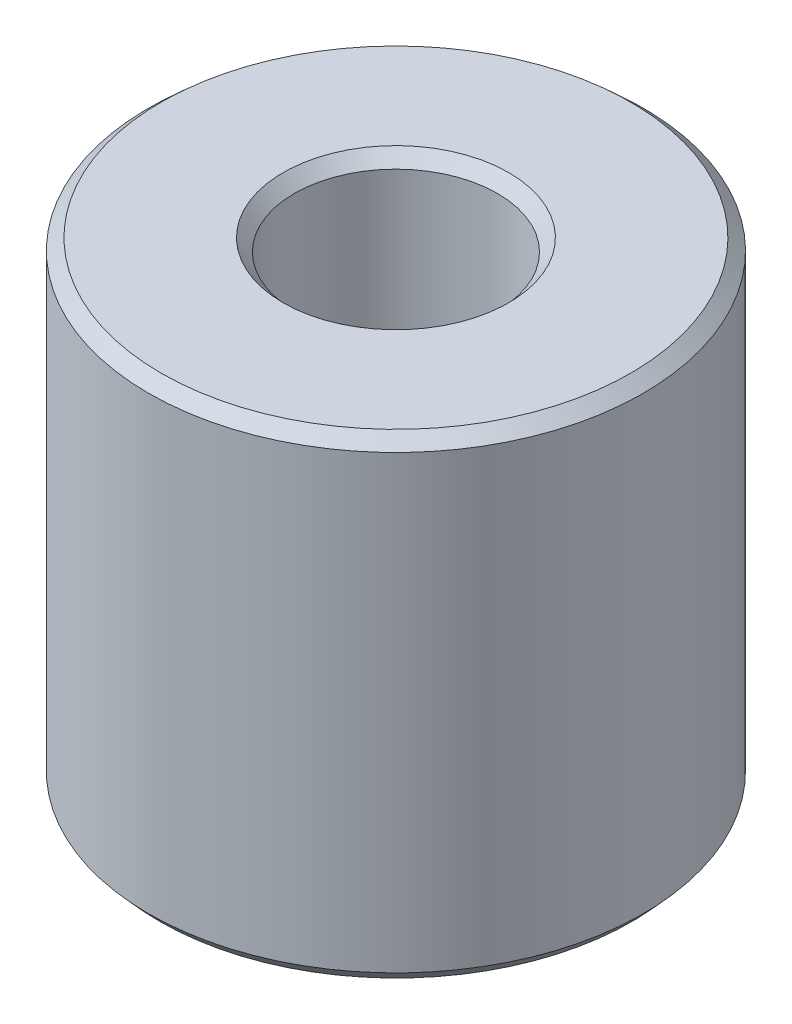
from build123d import *
from OCP.BRepFilletAPI import BRepFilletAPI_MakeChamfer

# Parameters (mm, degrees)
SKETCH1_R           = 57.5
BOSS_EXTRUDE1_DEPTH = 110.350583466
SKETCH2_R           = 23.616202796
CUT_EXTRUDE1_DEPTH  = 138.075713645
CHAMFER1_SIZE       = 2.621385551
CHAMFER1_SIZE2      = 2.889900043


with BuildPart() as part:
    # Sketch1 → Boss-Extrude1 (new body)
    with BuildSketch(Plane(origin=(0, 0, 0), x_dir=(1, 0, 0), z_dir=(0, 1, 0))):
        Circle(SKETCH1_R)
    extrude(amount=BOSS_EXTRUDE1_DEPTH)

    # Sketch2 → Cut-Extrude1 (cut, through all)
    with BuildSketch(Plane(origin=(0, 0, 0), x_dir=(1, 0, 0), z_dir=(0, 1, 0))):
        Circle(SKETCH2_R)
    extrude(amount=CUT_EXTRUDE1_DEPTH, mode=Mode.SUBTRACT)

    # Chamfer1: one chamfer whose edges measure the first distance from different faces: ONE call of the kernel's chamfer builder (chamfer() names one face for all edges)
    chamfer1_edges_1 = [part.edges().sort_by_distance(p)[0] for p in [
        (-23.616202796, 110.350583466, 0),
    ]]
    chamfer1_side_1 = [part.faces().sort_by_distance(p)[0] for p in [
        (-55.873654403, 110.350583466, 0),
    ]]
    chamfer1_edges_2 = [part.edges().sort_by_distance(p)[0] for p in [
        (-23.616202796, 0, 0),
    ]]
    chamfer1_side_2 = [part.faces().sort_by_distance(p)[0] for p in [
        (-23.616202796, 55.175291733, 0),
    ]]
    chamfer1_edges_3 = [part.edges().sort_by_distance(p)[0] for p in [
        (-57.5, 0, 0),
    ]]
    chamfer1_side_3 = [part.faces().sort_by_distance(p)[0] for p in [
        (-55.873654403, 0, 0),
    ]]
    chamfer1_edges_4 = [part.edges().sort_by_distance(p)[0] for p in [
        (-57.5, 110.350583466, 0),
    ]]
    chamfer1_side_4 = [part.faces().sort_by_distance(p)[0] for p in [
        (-57.5, 55.175291733, 0),
    ]]
    chamfer1 = BRepFilletAPI_MakeChamfer(part.part.solid().wrapped)
    for e in chamfer1_edges_1:
        chamfer1.Add(CHAMFER1_SIZE, CHAMFER1_SIZE2, e.wrapped, chamfer1_side_1[0].wrapped)  # the first distance lies on this face
    for e in chamfer1_edges_2:
        chamfer1.Add(CHAMFER1_SIZE, CHAMFER1_SIZE2, e.wrapped, chamfer1_side_2[0].wrapped)  # the first distance lies on this face
    for e in chamfer1_edges_3:
        chamfer1.Add(CHAMFER1_SIZE, CHAMFER1_SIZE2, e.wrapped, chamfer1_side_3[0].wrapped)  # the first distance lies on this face
    for e in chamfer1_edges_4:
        chamfer1.Add(CHAMFER1_SIZE, CHAMFER1_SIZE2, e.wrapped, chamfer1_side_4[0].wrapped)  # the first distance lies on this face
    add(Compound.cast(chamfer1.Shape()), mode=Mode.REPLACE)


solid = part.part
